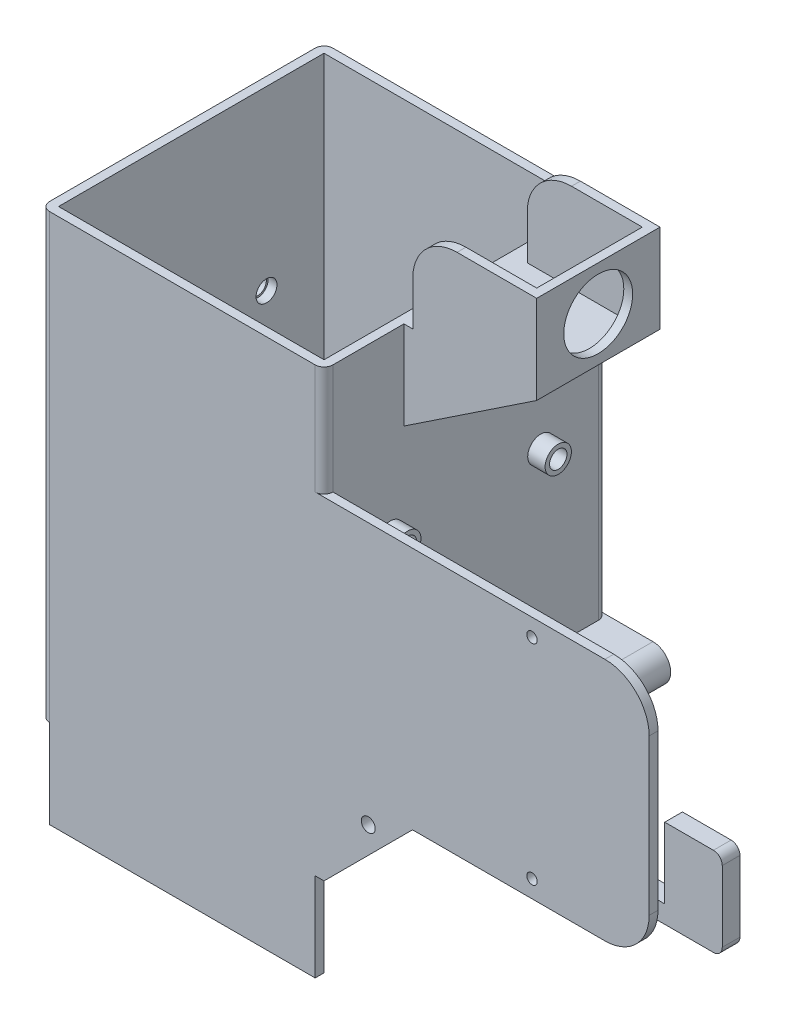
from build123d import *

# Parameters (mm, degrees)
SKETCH1_W            = 81.28
SKETCH1_H            = 81.28
SKETCH1_W_2          = 76.2
SKETCH1_H_2          = 76.2
BOSS_EXTRUDE1_DEPTH  = 177.8
SKETCH2_W            = 2.54
SKETCH2_H            = 38.1
BOSS_EXTRUDE2_DEPTH  = 25.4
SKETCH3_W            = 2.54
SKETCH3_H            = 25.4
CUT_EXTRUDE1_DEPTH   = 212.720846399
BOSS_EXTRUDE3_DEPTH  = 12.7
BOSS_EXTRUDE4_DEPTH  = 12.7
SKETCH14_W           = 5.08
SKETCH14_H           = 25.4
BOSS_EXTRUDE6_DEPTH  = 76.2
CUT_EXTRUDE2_REACH   = 243.407
SKETCH16_W           = 23.13
SKETCH16_H           = 20.32
SKETCH22_R           = 2
CUT_EXTRUDE6_DEPTH   = 252.036309724
SKETCH28_W           = 35.399999812
SKETCH28_H           = 50.8
BOSS_EXTRUDE7_DEPTH  = 38.1
CUT_EXTRUDE8_REACH   = 246.574
SKETCH32_W           = 33.02
SKETCH32_H           = 30.319999812
CUT_EXTRUDE9_DEPTH   = 25.4
CUT_EXTRUDE13_REACH  = 245.27
SKETCH34_R           = 9.890000016
BOSS_EXTRUDE9_DEPTH  = 2.54
SKETCH38_W           = 2.54
SKETCH38_H           = 25.4
CUT_EXTRUDE15_DEPTH  = 63.5
CUT_EXTRUDE17_REACH  = 224.71
SKETCH40_R           = 2.999995
SKETCH41_R           = 3.77
SKETCH41_R_2         = 2.5
BOSS_EXTRUDE10_DEPTH = 5
BOSS_EXTRUDE11_START = 5
SKETCH42_R           = 3.77
SKETCH42_R_2         = 2.5
BOSS_EXTRUDE11_DEPTH = 5
SKETCH43_W           = 76.2
SKETCH43_H           = 76.2
CUT_EXTRUDE20_DEPTH  = 25.4
SKETCH44_W           = 174.6
SKETCH44_H           = 70
SKETCH44_R           = 1.5
BOSS_EXTRUDE12_DEPTH = 2.54
FILLET1_R            = 5.08
FILLET2_R            = 12.7
FILLET3_R            = 2.54
FILLET7_R            = 12.7
FILLET9_R            = 12.7
BOSS_EXTRUDE20_DEPTH = 88.9
CUT_EXTRUDE21_REACH  = 275.109
SKETCH54_R           = 2.5
SKETCH55_W           = 30.48
SKETCH55_H           = 33.02
BOSS_EXTRUDE21_DEPTH = 2.54
FILLET12_R           = 2.54
FILLET13_R           = 2.54


with BuildPart() as part:
    # Sketch1 → Boss-Extrude1 (new body)
    with BuildSketch(Plane(origin=(0, 0, 0), x_dir=(1, 0, 0), z_dir=(0, 1, 0))):
        with Locations((40.64, 40.64)):
            Rectangle(SKETCH1_W, SKETCH1_H)
        with Locations((40.64, 40.64)):
            Rectangle(SKETCH1_W_2, SKETCH1_H_2, mode=Mode.SUBTRACT)
    extrude(amount=BOSS_EXTRUDE1_DEPTH)

    # Sketch2 → Boss-Extrude2 (add)
    with BuildSketch(Plane(origin=(0, 0, 0), x_dir=(0, 0, -1), z_dir=(1, 0, 0))):
        with Locations((64.77, 19.05)):
            Rectangle(SKETCH2_W, SKETCH2_H)
    extrude(amount=-BOSS_EXTRUDE2_DEPTH)

    # Sketch3 → Cut-Extrude1 (cut, through all)
    with BuildSketch(Plane.XY):
        with Locations((80.01, 12.7)):
            Rectangle(SKETCH3_W, SKETCH3_H)
    extrude(amount=-CUT_EXTRUDE1_DEPTH, mode=Mode.SUBTRACT)

    # Sketch7 → Boss-Extrude3 (add)
    with BuildSketch(Plane.XY):
        Polygon((81.28, 25.4), (106.68, 50.8), (81.28, 50.8), align=None)
    extrude(amount=-BOSS_EXTRUDE3_DEPTH)

    # Sketch10 → Boss-Extrude4 (add)
    with BuildSketch(Plane(origin=(0, 0, -81.28), x_dir=(-1, 0, 0), z_dir=(0, 0, -1))):
        Polygon((-81.28, 25.4), (-81.28, 50.8), (-106.68, 50.8), align=None)
    extrude(amount=-BOSS_EXTRUDE4_DEPTH)

    # Sketch14 → Boss-Extrude6 (add)
    with BuildSketch(Plane(origin=(81.28, 0, 0), x_dir=(0, 0, -1), z_dir=(1, 0, 0))):
        with Locations((40.64, 38.1)):
            Rectangle(SKETCH14_W, SKETCH14_H)
    extrude(amount=BOSS_EXTRUDE6_DEPTH)

    # Sketch16 → Cut-Extrude2 (cut, up to next)
    with BuildSketch(Plane.XY.offset(-38.1), mode=Mode.PRIVATE) as cut_extrude2_sk1:
        with Locations((129.405, 40.64)):
            Rectangle(SKETCH16_W, SKETCH16_H)
    cut_extrude2_tool1 = extrude(cut_extrude2_sk1.sketch, amount=-CUT_EXTRUDE2_REACH, mode=Mode.PRIVATE) & part.part
    add(cut_extrude2_tool1.solids().sort_by_distance((129.405, 40.64, -38.1))[0], mode=Mode.SUBTRACT)

    # Sketch22 → Cut-Extrude6 (cut, through all)
    with BuildSketch(Plane.XY):
        with Locations((93.98, 45.72)):
            Circle(SKETCH22_R)
    extrude(amount=-CUT_EXTRUDE6_DEPTH, mode=Mode.SUBTRACT)

    # Sketch28 → Boss-Extrude7 (add)
    with BuildSketch(Plane(origin=(81.28, 0, 0), x_dir=(0, 0, -1), z_dir=(1, 0, 0))):
        with Locations((40.64, 152.4)):
            Rectangle(SKETCH28_W, SKETCH28_H)
    extrude(amount=BOSS_EXTRUDE7_DEPTH)

    # Sketch30 → Cut-Extrude8 (cut, up to next)
    with BuildSketch(Plane.XY.offset(-22.940000094), mode=Mode.PRIVATE) as cut_extrude8_sk1:
        Polygon((81.28, 127), (119.38, 127), (119.38, 152.4), align=None)
    cut_extrude8_tool1 = extrude(cut_extrude8_sk1.sketch, amount=-CUT_EXTRUDE8_REACH, mode=Mode.PRIVATE) & part.part
    add(cut_extrude8_tool1.solids().sort_by_distance((106.68, 135.466667, -22.94))[0], mode=Mode.SUBTRACT)

    # Sketch32 → Cut-Extrude9 (cut)
    with BuildSketch(Plane(origin=(0, 177.8, 0), x_dir=(1, 0, 0), z_dir=(0, 1, 0))):
        with Locations((100.33, 40.64)):
            Rectangle(SKETCH32_W, SKETCH32_H)
    extrude(amount=-CUT_EXTRUDE9_DEPTH, mode=Mode.SUBTRACT)

    # Cut-Extrude13: up to this face of the body (flat: up to its plane)
    cut_extrude13_end = Plane(part.part.faces().sort_by_distance((78.74, 101.6, -40.64))[0])
    # Sketch34 → Cut-Extrude13 (cut, up to the picked face)
    with BuildSketch(Plane(origin=(119.38, 0, 0), x_dir=(0, 0, -1), z_dir=(1, 0, 0)), mode=Mode.PRIVATE) as cut_extrude13_sk1:
        with Locations(Location((40.593000094, 165.1, 0), (0, 0, 180))):
            Circle(SKETCH34_R)
    cut_extrude13_tool1 = split(extrude(cut_extrude13_sk1.sketch, amount=-CUT_EXTRUDE13_REACH, mode=Mode.PRIVATE), bisect_by=cut_extrude13_end, keep=Keep.BOTH, mode=Mode.PRIVATE)
    add(cut_extrude13_tool1.solids().sort_by(Axis((119.38, 165.1, -40.593), (-1, 0, 0)))[0], mode=Mode.SUBTRACT)

    # Sketch37 → Boss-Extrude9 (add)
    with BuildSketch(Plane.XY.offset(-63.5)):
        Polygon((-25.4, 38.1), (0, 38.1), (0, 52.764696837), align=None)
    extrude(amount=-BOSS_EXTRUDE9_DEPTH)

    # Sketch38 → Cut-Extrude15 (cut)
    with BuildSketch(Plane.XY):
        with Locations((1.27, 12.7)):
            Rectangle(SKETCH38_W, SKETCH38_H)
    extrude(amount=-CUT_EXTRUDE15_DEPTH, mode=Mode.SUBTRACT)

    # Cut-Extrude17: up to this face of the body (flat: up to its plane)
    cut_extrude17_end = Plane(part.part.faces().sort_by_distance((0, 99.23335202, -41.514066738))[0])
    # Sketch40 → Cut-Extrude17 (cut, up to the picked face)
    with BuildSketch(Plane(origin=(81.28, 0, 0), x_dir=(0, 0, -1), z_dir=(1, 0, 0)), mode=Mode.PRIVATE) as cut_extrude17_sk1:
        with Locations((19.05, 101.6)):
            Circle(SKETCH40_R)
    cut_extrude17_tool1 = split(extrude(cut_extrude17_sk1.sketch, amount=-CUT_EXTRUDE17_REACH, mode=Mode.PRIVATE), bisect_by=cut_extrude17_end, keep=Keep.BOTH, mode=Mode.PRIVATE)
    # Sketch40 → Cut-Extrude17 (cut, up to the picked face)
    with BuildSketch(Plane(origin=(81.28, 0, 0), x_dir=(0, 0, -1), z_dir=(1, 0, 0)), mode=Mode.PRIVATE) as cut_extrude17_sk2:
        with Locations((62.23, 101.6)):
            Circle(SKETCH40_R)
    cut_extrude17_tool2 = split(extrude(cut_extrude17_sk2.sketch, amount=-CUT_EXTRUDE17_REACH, mode=Mode.PRIVATE), bisect_by=cut_extrude17_end, keep=Keep.BOTH, mode=Mode.PRIVATE)
    add(cut_extrude17_tool1.solids().sort_by(Axis((81.28, 101.6, -19.05), (-1, 0, 0)))[0], mode=Mode.SUBTRACT)
    add(cut_extrude17_tool2.solids().sort_by(Axis((81.28, 101.6, -62.23), (-1, 0, 0)))[0], mode=Mode.SUBTRACT)

    # Sketch41 → Boss-Extrude10 (add)
    # profile 1 of 2: a face of its own
    with BuildSketch(Plane(origin=(81.28, 0, 0), x_dir=(0, 0, -1), z_dir=(1, 0, 0))):
        with Locations(Location((19.05, 101.6, 0), (0, 0, 180))):
            Circle(SKETCH41_R)
        with Locations((19.05, 101.6)):
            Circle(SKETCH41_R_2, mode=Mode.SUBTRACT)
    # profile 2 of 2: a face of its own
    with BuildSketch(Plane(origin=(81.28, 0, 0), x_dir=(0, 0, -1), z_dir=(1, 0, 0))):
        with Locations(Location((62.23, 101.6, 0), (0, 0, 180))):
            Circle(SKETCH41_R)
        with Locations((62.23, 101.6)):
            Circle(SKETCH41_R_2, mode=Mode.SUBTRACT)
    extrude(amount=BOSS_EXTRUDE10_DEPTH)

    # Sketch42 → Boss-Extrude11 (add)
    # profile 1 of 2: a face of its own
    with BuildSketch(Plane.ZY.offset(BOSS_EXTRUDE11_START)):
        with Locations((-62.23, 101.6)):
            Circle(SKETCH42_R)
        with Locations(Location((-62.23, 101.6, 0), (0, 0, 180))):
            Circle(SKETCH42_R_2, mode=Mode.SUBTRACT)
    # profile 2 of 2: a face of its own
    with BuildSketch(Plane.ZY.offset(BOSS_EXTRUDE11_START)):
        with Locations((-19.05, 101.6)):
            Circle(SKETCH42_R)
        with Locations(Location((-19.05, 101.6, 0), (0, 0, 180))):
            Circle(SKETCH42_R_2, mode=Mode.SUBTRACT)
    extrude(amount=-BOSS_EXTRUDE11_DEPTH)

    # Sketch43 → Cut-Extrude20 (cut)
    with BuildSketch(Plane(origin=(0, 177.8, 0), x_dir=(1, 0, 0), z_dir=(0, 1, 0))):
        Polygon((83.82, 58.339999906), (83.82, 22.940000094), (81.28, 22.940000094), (81.28, 0), (0, 0), (0, 81.28), (81.28, 81.28), (81.28, 58.339999906), align=None)
        with Locations((40.64, 40.64)):
            Rectangle(SKETCH43_W, SKETCH43_H, mode=Mode.SUBTRACT)
    extrude(amount=-CUT_EXTRUDE20_DEPTH, mode=Mode.SUBTRACT)

    # Sketch44 → Boss-Extrude12 (add)
    with BuildSketch(Plane.XY):
        with Locations((87.3, 85.8)):
            Rectangle(SKETCH44_W, SKETCH44_H)
        with Locations((140.97, 115.8)):
            Circle(SKETCH44_R, mode=Mode.SUBTRACT)
        with Locations((140.97, 55.8)):
            Circle(SKETCH44_R, mode=Mode.SUBTRACT)
    extrude(amount=-BOSS_EXTRUDE12_DEPTH)

    # Fillet1
    fillet1_edges = [part.edges().sort_by_distance(p)[0] for p in [
        (106.68, 50.8, -7.62),
        (106.68, 50.8, -74.93),
    ]]
    fillet(fillet1_edges, radius=FILLET1_R)

    # Fillet2
    fillet2_edges = [part.edges().sort_by_distance(p)[0] for p in [
        (174.6, 120.8, -1.27),
        (174.6, 50.8, -1.27),
    ]]
    fillet(fillet2_edges, radius=FILLET2_R)

    # Fillet3
    fillet3_edges = [part.edges().sort_by_distance(p)[0] for p in [
        (157.48, 50.8, -40.64),
        (157.48, 25.4, -40.64),
    ]]
    fillet(fillet3_edges, radius=FILLET3_R)

    # Fillet7
    fillet7_edges = [part.edges().sort_by_distance(p)[0] for p in [
        (-25.4, 38.1, -64.77),
    ]]
    fillet(fillet7_edges, radius=FILLET7_R)

    # Fillet9
    fillet9_edges = [part.edges().sort_by_distance(p)[0] for p in [
        (83.82, 177.8, -24.210000094),
        (83.82, 177.8, -57.069999906),
    ]]
    fillet(fillet9_edges, radius=FILLET9_R)

    # Sketch53 → Boss-Extrude20 (add)
    with BuildSketch(Plane(origin=(0, 0, 0), x_dir=(-1, 0, 0), z_dir=(0, -1, 0))):
        Polygon((-35.659105782, 81.28), (-35.659105782, 78.74), (-45.72, 78.74), (-45.72, 111.76), (-15.24, 111.76), (-15.24, 106.68), (-40.64, 106.68), (-40.64, 81.28), align=None)
    extrude(amount=-BOSS_EXTRUDE20_DEPTH)

    # Sketch54 → Cut-Extrude21 (cut, up to next)
    with BuildSketch(Plane(origin=(0, 0, -111.76), x_dir=(-1, 0, 0), z_dir=(0, 0, -1)), mode=Mode.PRIVATE) as cut_extrude21_sk1:
        with Locations((-30.48, 76.2)):
            Circle(SKETCH54_R)
    cut_extrude21_tool1 = extrude(cut_extrude21_sk1.sketch, amount=-CUT_EXTRUDE21_REACH, mode=Mode.PRIVATE) & part.part
    # Sketch54 → Cut-Extrude21 (cut, up to next)
    with BuildSketch(Plane(origin=(0, 0, -111.76), x_dir=(-1, 0, 0), z_dir=(0, 0, -1)), mode=Mode.PRIVATE) as cut_extrude21_sk2:
        with Locations((-30.48, 44.45)):
            Circle(SKETCH54_R)
    cut_extrude21_tool2 = extrude(cut_extrude21_sk2.sketch, amount=-CUT_EXTRUDE21_REACH, mode=Mode.PRIVATE) & part.part
    # Sketch54 → Cut-Extrude21 (cut, up to next)
    with BuildSketch(Plane(origin=(0, 0, -111.76), x_dir=(-1, 0, 0), z_dir=(0, 0, -1)), mode=Mode.PRIVATE) as cut_extrude21_sk3:
        with Locations((-30.48, 12.7)):
            Circle(SKETCH54_R)
    cut_extrude21_tool3 = extrude(cut_extrude21_sk3.sketch, amount=-CUT_EXTRUDE21_REACH, mode=Mode.PRIVATE) & part.part
    add(cut_extrude21_tool1.solids().sort_by_distance((30.48, 76.2, -111.76))[0], mode=Mode.SUBTRACT)
    add(cut_extrude21_tool2.solids().sort_by_distance((30.48, 44.45, -111.76))[0], mode=Mode.SUBTRACT)
    add(cut_extrude21_tool3.solids().sort_by_distance((30.48, 12.7, -111.76))[0], mode=Mode.SUBTRACT)

    # Sketch55 → Boss-Extrude21 (add)
    with BuildSketch(Plane(origin=(0, 0, 0), x_dir=(-1, 0, 0), z_dir=(0, -1, 0))):
        with Locations((-30.48, 95.25)):
            Rectangle(SKETCH55_W, SKETCH55_H)
    extrude(amount=-BOSS_EXTRUDE21_DEPTH)

    # Fillet12
    fillet12_edges = [part.edges().sort_by_distance(p)[0] for p in [
        (81.28, 136.6, 0),
        (81.28, 101.6, -81.28),
        (0, 76.2, -81.28),
        (0, 88.9, 0),
    ]]
    fillet(fillet12_edges, radius=FILLET12_R)

    # Fillet13
    fillet13_edges = [part.edges().sort_by_distance(p)[0] for p in [
        (15.24, 45.72, -106.68),
        (15.24, 44.45, -111.76),
    ]]
    fillet(fillet13_edges, radius=FILLET13_R - 0.0001)  # a hair under: the kernel refuses the full size


solid = part.part
